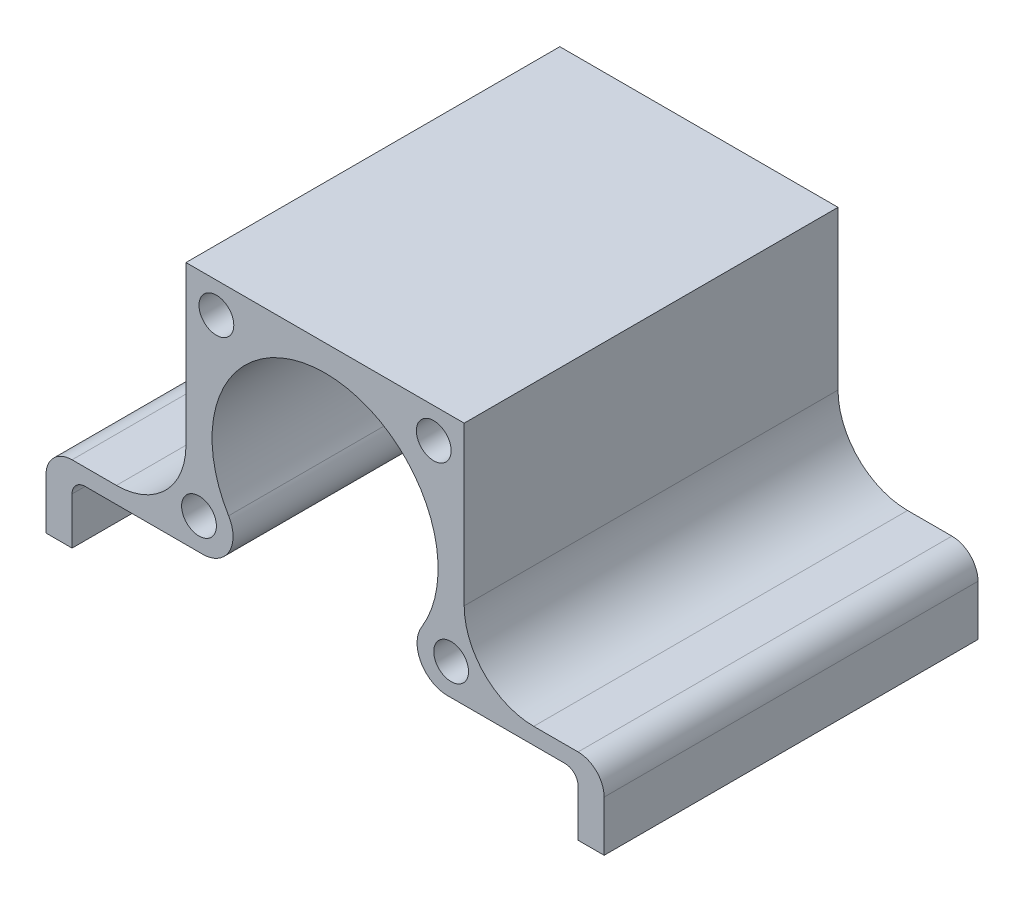
from build123d import *

# Parameters (mm, degrees)
BOSS_EXTRUDE1_DEPTH = 43
FILLET3_R           = 8
CUT_EXTRUDE5_REACH  = 67.753
SKETCH5_R           = 2
FILLET1_R           = 1.5
FILLET2_R           = 3
FILLET4_R           = 3.5


with BuildPart() as part:
    # Sketch1 → Boss-Extrude1 (new body)
    with BuildSketch(Plane.XY):
        with BuildLine():
            Line((16, 38), (-16, 38))
            Line((-16, 38), (-16, 11.8))
            Line((-16, 11.8), (-32.1, 11.8))
            Line((-32.1, 11.8), (-32.1, 3))
            Line((-32.1, 3), (-29.1, 3))
            Line((-29.1, 3), (-29.1, 9.9))
            Line((-29.1, 9.9), (-4.752893855, 9.9))
            ThreePointArc((-4.752893855, 9.9), (-7.321624816, 32.742151091), (13, 22))
            ThreePointArc((13, 22), (10.742151091, 14.678375184), (4.752893855, 9.9))
            Line((4.752893855, 9.9), (29.1, 9.9))
            Line((29.1, 9.9), (29.1, 3))
            Line((29.1, 3), (32.1, 3))
            Line((32.1, 3), (32.1, 11.8))
            Line((32.1, 11.8), (16, 11.8))
            Line((16, 11.8), (16, 38))
        make_face()
    extrude(amount=BOSS_EXTRUDE1_DEPTH)

    # Fillet3
    fillet3_edges = [part.edges().sort_by_distance(p)[0] for p in [
        (16, 11.8, 21.5),
        (-16, 11.8, 21.5),
    ]]
    fillet(fillet3_edges, radius=FILLET3_R)

    # Sketch5 → Cut-Extrude5 (cut, up to next)
    with BuildSketch(Plane(origin=(0, 0, 0), x_dir=(-1, 0, 0), z_dir=(0, 0, -1)), mode=Mode.PRIVATE) as cut_extrude5_sk1:
        with Locations((-12.5, 34.5)):
            Circle(SKETCH5_R)
    cut_extrude5_tool1 = extrude(cut_extrude5_sk1.sketch, amount=-CUT_EXTRUDE5_REACH, mode=Mode.PRIVATE) & part.part
    # Sketch5 → Cut-Extrude5 (cut, up to next)
    with BuildSketch(Plane(origin=(0, 0, 0), x_dir=(-1, 0, 0), z_dir=(0, 0, -1)), mode=Mode.PRIVATE) as cut_extrude5_sk2:
        with Locations((12.5, 34.5)):
            Circle(SKETCH5_R)
    cut_extrude5_tool2 = extrude(cut_extrude5_sk2.sketch, amount=-CUT_EXTRUDE5_REACH, mode=Mode.PRIVATE) & part.part
    # Sketch5 → Cut-Extrude5 (cut, up to next)
    with BuildSketch(Plane(origin=(0, 0, 0), x_dir=(-1, 0, 0), z_dir=(0, 0, -1)), mode=Mode.PRIVATE) as cut_extrude5_sk3:
        with Locations((-14.5, 13.5)):
            Circle(SKETCH5_R)
    cut_extrude5_tool3 = extrude(cut_extrude5_sk3.sketch, amount=-CUT_EXTRUDE5_REACH, mode=Mode.PRIVATE) & part.part
    # Sketch5 → Cut-Extrude5 (cut, up to next)
    with BuildSketch(Plane(origin=(0, 0, 0), x_dir=(-1, 0, 0), z_dir=(0, 0, -1)), mode=Mode.PRIVATE) as cut_extrude5_sk4:
        with Locations((14.5, 13.5)):
            Circle(SKETCH5_R)
    cut_extrude5_tool4 = extrude(cut_extrude5_sk4.sketch, amount=-CUT_EXTRUDE5_REACH, mode=Mode.PRIVATE) & part.part
    add(cut_extrude5_tool1.solids().sort_by_distance((12.5, 34.5, 0))[0], mode=Mode.SUBTRACT)
    add(cut_extrude5_tool2.solids().sort_by_distance((-12.5, 34.5, 0))[0], mode=Mode.SUBTRACT)
    add(cut_extrude5_tool3.solids().sort_by_distance((14.5, 13.5, 0))[0], mode=Mode.SUBTRACT)
    add(cut_extrude5_tool4.solids().sort_by_distance((-14.5, 13.5, 0))[0], mode=Mode.SUBTRACT)

    # Fillet1
    fillet1_edges = [part.edges().sort_by_distance(p)[0] for p in [
        (29.1, 9.9, 21.5),
        (-29.1, 9.9, 21.5),
    ]]
    fillet(fillet1_edges, radius=FILLET1_R)

    # Fillet2
    fillet2_edges = [part.edges().sort_by_distance(p)[0] for p in [
        (32.1, 11.8, 21.5),
        (-32.1, 11.8, 21.5),
    ]]
    fillet(fillet2_edges, radius=FILLET2_R)

    # Fillet4
    fillet4_edges = [part.edges().sort_by_distance(p)[0] for p in [
        (-4.752893855, 9.9, 21.5),
        (4.752893855, 9.9, 21.5),
    ]]
    fillet(fillet4_edges, radius=FILLET4_R)


solid = part.part
